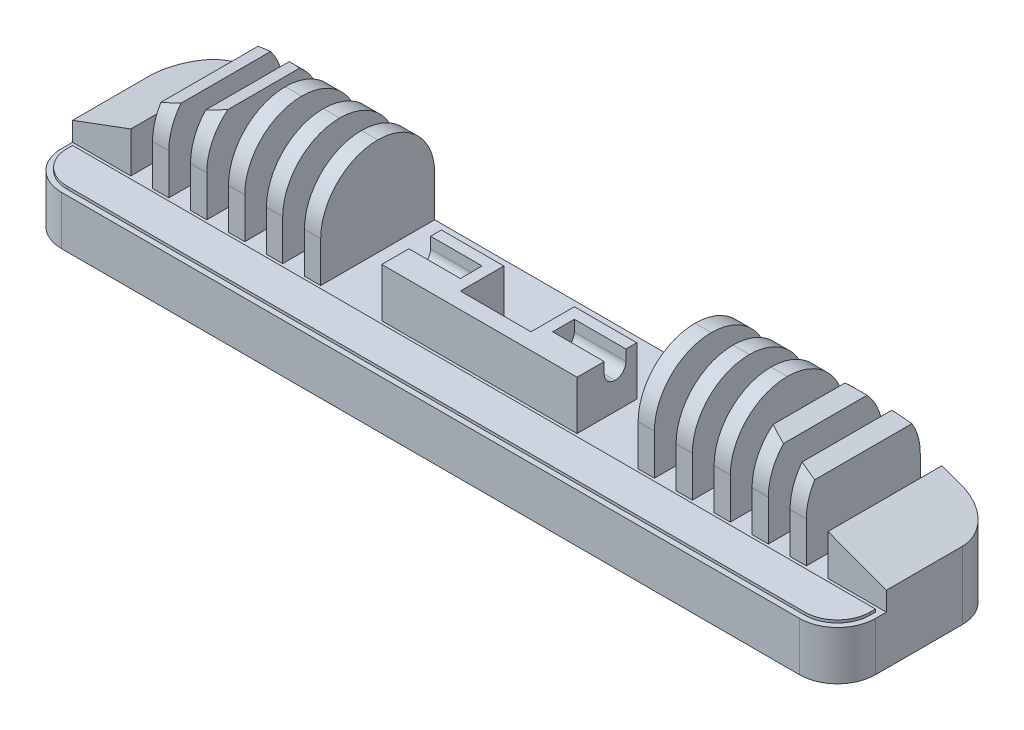
from build123d import *

# Parameters (mm, degrees)
BOSS_EXTRUDE1_DEPTH    = 9
BOSS_EXTRUDE2_DEPTH    = 0.5
SKETCH3_W              = 3
SKETCH3_H              = 21
BOSS_EXTRUDE3_DEPTH    = 7.5
CHAMFER1_SIZE          = 10.75
CHAMFER1_SIZE_2        = 4
CHAMFER2_SIZE          = 4
CHAMFER2_SIZE_2        = 10.75
SKETCH4_W              = 3
SKETCH4_H              = 21
BOSS_EXTRUDE4_DEPTH    = 10.5
FILLET1_R              = 10.5
CUT_EXTRUDE1_START     = 22.980740698
CUT_EXTRUDE1_OUTLINE_W = 3
CUT_EXTRUDE1_OUTLINE_H = 19
CUT_EXTRUDE1_DEPTH     = 4.019259302
CHAMFER3_SIZE2         = 3
CHAMFER3_SIZE          = 1
CUT_EXTRUDE2_START     = 24.646741863
CUT_EXTRUDE2_OUTLINE_W = 3
CUT_EXTRUDE2_OUTLINE_H = 17
CUT_EXTRUDE2_DEPTH     = 2.353258137
CHAMFER4_SIZE2         = 3
CHAMFER4_SIZE          = 1
CUT_EXTRUDE3_START     = 22.980740698
CUT_EXTRUDE3_OUTLINE_W = 3
CUT_EXTRUDE3_OUTLINE_H = 19
CUT_EXTRUDE3_DEPTH     = 4.019259302
CUT_EXTRUDE4_START     = 24.646741863
CUT_EXTRUDE4_OUTLINE_W = 3
CUT_EXTRUDE4_OUTLINE_H = 17
CUT_EXTRUDE4_DEPTH     = 2.353258137
CHAMFER5_SIZE2         = 3
CHAMFER5_SIZE          = 1
CHAMFER6_SIZE2         = 3
CHAMFER6_SIZE          = 1
BOSS_EXTRUDE5_DEPTH    = 9
SKETCH10_W             = 9.5
SKETCH10_H             = 4
CUT_EXTRUDE5_DEPTH     = 4
FILLET2_R              = 2
FILLET3_R              = 2


# Read off the part's stored shape, not the designer's step: Cut-Extrude1, Cut-Extrude2, Cut-Extrude3, Cut-Extrude4
# Some blends are built 0.0001 mm under size
with BuildPart() as part:
    # Sketch1 → Boss-Extrude1 (new body)
    with BuildSketch(Plane(origin=(0, 0, 0), x_dir=(1, 0, 0), z_dir=(0, 1, 0))):
        with BuildLine():
            Line((0, 15), (68, 15))
            ThreePointArc((68, 15), (72.949747468, 12.949747468), (75, 8))
            Line((75, 8), (75, -8))
            ThreePointArc((75, -8), (72.949747468, -12.949747468), (68, -15))
            Line((68, -15), (-68, -15))
            ThreePointArc((-68, -15), (-72.949747468, -12.949747468), (-75, -8))
            Line((-75, -8), (-75, 8))
            ThreePointArc((-75, 8), (-72.949747468, 12.949747468), (-68, 15))
            Line((-68, 15), (0, 15))
        make_face()
    extrude(amount=BOSS_EXTRUDE1_DEPTH)

    # Sketch2 → Boss-Extrude2 (add)
    with BuildSketch(Plane(origin=(0, 9, 0), x_dir=(1, 0, 0), z_dir=(0, 1, 0))):
        with BuildLine():
            Line((74, -7), (-74, -7))
            Line((-74, -7), (-74, -8))
            ThreePointArc((-74, -8), (-72.242640687, -12.242640687), (-68, -14))
            Line((-68, -14), (68, -14))
            ThreePointArc((68, -14), (72.242640687, -12.242640687), (74, -8))
            Line((74, -8), (74, -7))
        make_face()
    extrude(amount=BOSS_EXTRUDE2_DEPTH)

    # Sketch3 → Boss-Extrude3 (add)
    with BuildSketch(Plane(origin=(0, 9, 0), x_dir=(1, 0, 0), z_dir=(0, 1, 0))):
        with BuildLine():
            Line((64.25, -6), (75, -6))
            Line((75, -6), (75, 8))
            ThreePointArc((75, 8), (72.949747468, 12.949747468), (68, 15))
            Line((68, 15), (64.25, 15))
            Line((64.25, 15), (64.25, -6))
        make_face()
        with BuildLine():
            Line((-75, -6), (-64.25, -6))
            Line((-64.25, -6), (-64.25, 15))
            Line((-64.25, 15), (-68, 15))
            ThreePointArc((-68, 15), (-72.949747468, 12.949747468), (-75, 8))
            Line((-75, 8), (-75, -6))
        make_face()
        with Locations((-58.75, 4.5)):
            Rectangle(SKETCH3_W, SKETCH3_H)
        with Locations((-51.75, 4.5)):
            Rectangle(SKETCH3_W, SKETCH3_H)
        with Locations((-44.75, 4.5)):
            Rectangle(SKETCH3_W, SKETCH3_H)
        with Locations((-37.75, 4.5)):
            Rectangle(SKETCH3_W, SKETCH3_H)
        with Locations((-30.75, 4.5)):
            Rectangle(SKETCH3_W, SKETCH3_H)
        with Locations((30.75, 4.5)):
            Rectangle(SKETCH3_W, SKETCH3_H)
        with Locations((37.75, 4.5)):
            Rectangle(SKETCH3_W, SKETCH3_H)
        with Locations((44.75, 4.5)):
            Rectangle(SKETCH3_W, SKETCH3_H)
        with Locations((51.75, 4.5)):
            Rectangle(SKETCH3_W, SKETCH3_H)
        with Locations((58.75, 4.5)):
            Rectangle(SKETCH3_W, SKETCH3_H)
    extrude(amount=BOSS_EXTRUDE3_DEPTH)

    # Chamfer1
    # the kernel refuses this chamfer: 10.75, 4 mm, written as the material it takes off along each edge
    with BuildSketch(Plane(origin=(-75, 16.5, -35.885033622), x_dir=(0.9999096242158825, 0.013444084217698377, 0), z_dir=(0, 0, 1))) as chamfer1_piece_1:
        Polygon((CHAMFER1_SIZE * 0.999909624216, -CHAMFER1_SIZE * 0.0134440842177), (-CHAMFER1_SIZE_2 * 0.0134440842177, -CHAMFER1_SIZE_2 * 0.999909624216), (0, 0), align=None)
    extrude(amount=69.770067243, mode=Mode.SUBTRACT)

    # Chamfer2
    # the kernel refuses this chamfer: 10.75, 4 mm, written as the material it takes off along each edge
    with BuildSketch(Plane(origin=(75, 16.5, 33.885033622), x_dir=(0.09665608708749646, -0.9953178390991163, 0), z_dir=(0, 0, -1))) as chamfer2_piece_1:
        Polygon((CHAMFER2_SIZE * 0.995317839099, CHAMFER2_SIZE * 0.0966560870875), (-CHAMFER2_SIZE_2 * 0.0966560870875, CHAMFER2_SIZE_2 * 0.995317839099), (0, 0), align=None)
    extrude(amount=69.770067243, mode=Mode.SUBTRACT)

    # Sketch4 → Boss-Extrude4 (add)
    with BuildSketch(Plane(origin=(0, 16.5, 0), x_dir=(1, 0, 0), z_dir=(0, 1, 0))):
        with Locations((-44.75, 4.5)):
            Rectangle(SKETCH4_W, SKETCH4_H)
        with Locations((-37.75, 4.5)):
            Rectangle(SKETCH4_W, SKETCH4_H)
        with Locations((-30.75, 4.5)):
            Rectangle(SKETCH4_W, SKETCH4_H)
        with Locations((30.75, 4.5)):
            Rectangle(SKETCH4_W, SKETCH4_H)
        with Locations((37.75, 4.5)):
            Rectangle(SKETCH4_W, SKETCH4_H)
        with Locations((44.75, 4.5)):
            Rectangle(SKETCH4_W, SKETCH4_H)
        with Locations((51.75, 4.5)):
            Rectangle(SKETCH4_W, SKETCH4_H)
        with Locations((58.75, 4.5)):
            Rectangle(SKETCH4_W, SKETCH4_H)
        with Locations((-51.75, 4.5)):
            Rectangle(SKETCH4_W, SKETCH4_H)
        with Locations((-58.75, 4.5)):
            Rectangle(SKETCH4_W, SKETCH4_H)
    extrude(amount=BOSS_EXTRUDE4_DEPTH)

    # Fillet1
    fillet1_edges = [part.edges().sort_by_distance(p)[0] for p in [
        (30.75, 27, 6),
        (37.75, 27, 6),
        (44.75, 27, 6),
        (51.75, 27, 6),
        (58.75, 27, 6),
        (58.75, 27, -15),
        (51.75, 27, -15),
        (44.75, 27, -15),
        (37.75, 27, -15),
        (30.75, 27, -15),
        (-30.75, 27, 6),
        (-37.75, 27, 6),
        (-44.75, 27, 6),
        (-51.75, 27, 6),
        (-58.75, 27, 6),
        (-30.75, 27, -15),
        (-37.75, 27, -15),
        (-44.75, 27, -15),
        (-51.75, 27, -15),
        (-58.75, 27, -15),
    ]]
    fillet(fillet1_edges, radius=FILLET1_R - 0.0001)  # a hair under: the kernel refuses the full size

    # Cut-Extrude1 outline → Cut-Extrude1 (cut)
    with BuildSketch(Plane(origin=(0, 0, 0), x_dir=(1, 0, 0), z_dir=(0, 1, 0)).offset(CUT_EXTRUDE1_START)):
        with Locations((-58.75, 4.5)):
            Rectangle(CUT_EXTRUDE1_OUTLINE_W, CUT_EXTRUDE1_OUTLINE_H)
    extrude(amount=CUT_EXTRUDE1_DEPTH, mode=Mode.SUBTRACT)

    # Chamfer3
    chamfer3_edges = [part.edges().sort_by_distance(p)[0] for p in [
        (-60.25, 22.980740698, -4.5),
    ]]
    chamfer3_side = [part.faces().sort_by_distance(p)[0] for p in [
        (-60.25, 22.960740698, -4.5),
    ]]
    chamfer(chamfer3_edges, length=CHAMFER3_SIZE - 0.0001, length2=CHAMFER3_SIZE2 - 0.0001, reference=chamfer3_side[0])  # a hair under: the kernel refuses the full size

    # Cut-Extrude2 outline → Cut-Extrude2 (cut)
    with BuildSketch(Plane(origin=(0, 0, 0), x_dir=(1, 0, 0), z_dir=(0, 1, 0)).offset(CUT_EXTRUDE2_START)):
        with Locations((-51.75, 4.5)):
            Rectangle(CUT_EXTRUDE2_OUTLINE_W, CUT_EXTRUDE2_OUTLINE_H)
    extrude(amount=CUT_EXTRUDE2_DEPTH, mode=Mode.SUBTRACT)

    # Chamfer4
    chamfer4_edges = [part.edges().sort_by_distance(p)[0] for p in [
        (-53.25, 24.646741863, -4.5),
    ]]
    chamfer4_side = [part.faces().sort_by_distance(p)[0] for p in [
        (-53.25, 24.626741863, -4.5),
    ]]
    chamfer(chamfer4_edges, length=CHAMFER4_SIZE - 0.0001, length2=CHAMFER4_SIZE2 - 0.0001, reference=chamfer4_side[0])  # a hair under: the kernel refuses the full size

    # Cut-Extrude3 outline → Cut-Extrude3 (cut)
    with BuildSketch(Plane(origin=(0, 0, 0), x_dir=(1, 0, 0), z_dir=(0, 1, 0)).offset(CUT_EXTRUDE3_START)):
        with Locations((58.75, 4.5)):
            Rectangle(CUT_EXTRUDE3_OUTLINE_W, CUT_EXTRUDE3_OUTLINE_H)
    extrude(amount=CUT_EXTRUDE3_DEPTH, mode=Mode.SUBTRACT)

    # Cut-Extrude4 outline → Cut-Extrude4 (cut)
    with BuildSketch(Plane(origin=(0, 0, 0), x_dir=(1, 0, 0), z_dir=(0, 1, 0)).offset(CUT_EXTRUDE4_START)):
        with Locations((51.75, 4.5)):
            Rectangle(CUT_EXTRUDE4_OUTLINE_W, CUT_EXTRUDE4_OUTLINE_H)
    extrude(amount=CUT_EXTRUDE4_DEPTH, mode=Mode.SUBTRACT)

    # Chamfer5
    chamfer5_edges = [part.edges().sort_by_distance(p)[0] for p in [
        (60.25, 22.980740698, -4.5),
    ]]
    chamfer5_side = [part.faces().sort_by_distance(p)[0] for p in [
        (60.25, 22.960740698, -4.5),
    ]]
    chamfer(chamfer5_edges, length=CHAMFER5_SIZE - 0.0001, length2=CHAMFER5_SIZE2 - 0.0001, reference=chamfer5_side[0])  # a hair under: the kernel refuses the full size

    # Chamfer6
    chamfer6_edges = [part.edges().sort_by_distance(p)[0] for p in [
        (53.25, 24.646741863, -4.5),
    ]]
    chamfer6_side = [part.faces().sort_by_distance(p)[0] for p in [
        (53.25, 24.626741863, -4.5),
    ]]
    chamfer(chamfer6_edges, length=CHAMFER6_SIZE - 0.0001, length2=CHAMFER6_SIZE2 - 0.0001, reference=chamfer6_side[0])  # a hair under: the kernel refuses the full size

    # Sketch9 → Boss-Extrude5 (add)
    with BuildSketch(Plane(origin=(0, 9, 0), x_dir=(1, 0, 0), z_dir=(0, 1, 0))):
        Polygon((-18, 5), (-6.5, 5), (-6.5, -3), (6.5, -3), (6.5, 5), (18, 5), (18, -6), (-18, -6), align=None)
    extrude(amount=BOSS_EXTRUDE5_DEPTH)

    # Sketch10 → Cut-Extrude5 (cut)
    with BuildSketch(Plane(origin=(0, 18, 0), x_dir=(1, 0, 0), z_dir=(0, 1, 0))):
        with Locations((13.25, 1)):
            Rectangle(SKETCH10_W, SKETCH10_H)
        with Locations((-13.25, 1)):
            Rectangle(SKETCH10_W, SKETCH10_H)
    extrude(amount=-CUT_EXTRUDE5_DEPTH, mode=Mode.SUBTRACT)

    # Fillet2
    fillet2_edges = [part.edges().sort_by_distance(p)[0] for p in [
        (13.25, 14, -3),
        (-13.25, 14, -3),
    ]]
    fillet(fillet2_edges, radius=FILLET2_R)

    # Fillet3
    fillet3_edges = [part.edges().sort_by_distance(p)[0] for p in [
        (-13.25, 14, 1),
        (13.25, 14, 1),
    ]]
    fillet(fillet3_edges, radius=FILLET3_R - 0.0001)  # a hair under: the kernel refuses the full size


solid = part.part
